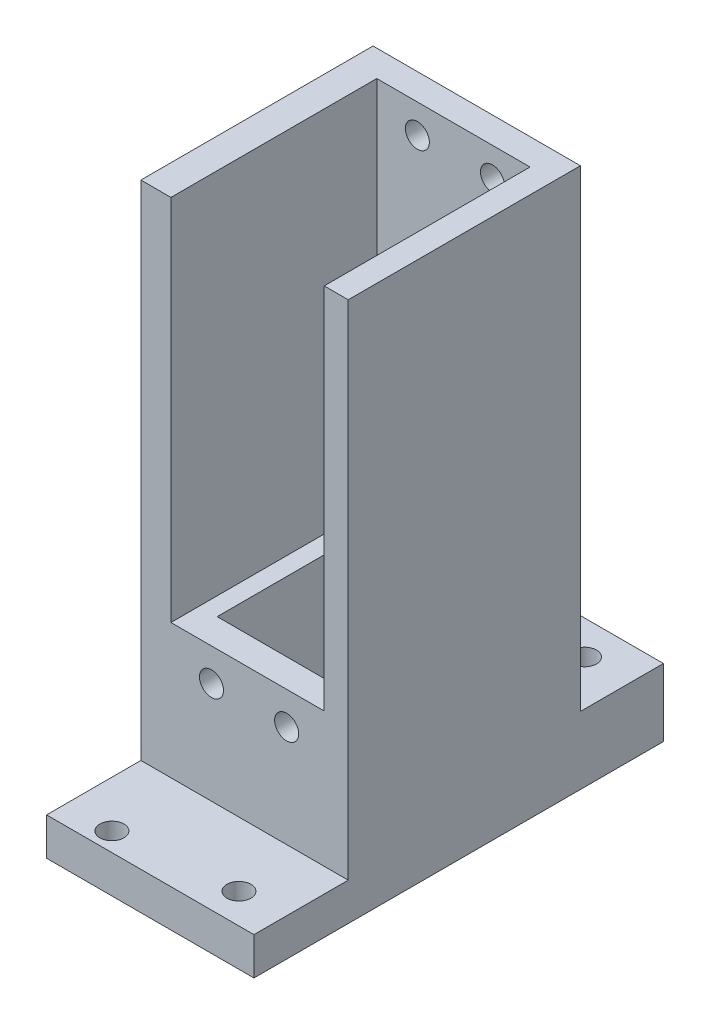
from build123d import *

# Parameters (mm, degrees)
SKETCH1_W               = 25
SKETCH1_H               = 17
BOSS_EXTRUDE1_DEPTH     = 12
MOVE_FACE1_BY           = 15
MOVE_FACE3_BY           = 8
SKETCH3_W               = 25
SKETCH3_H               = 12.751689795
BOSS_EXTRUDE2_DEPTH     = 6.9
SKETCH4_W               = 5
SKETCH4_H               = 16.698310205
BOSS_EXTRUDE3_DEPTH     = 6.9
MOVE_START              = -11.609792285
MOVE_FACE4_OUTLINE_W    = 6.9
MOVE_FACE4_OUTLINE_H    = 16.698310205
MOVE_FACE4_DEPTH        = 2.4
MOVE_FACE5_BY           = 20
SKETCH6_W               = 25
SKETCH6_H               = 10.9
BOSS_EXTRUDE5_DEPTH     = 2
MOVE_FACE6_BY           = 1.5
MOVE_FACE7_BY           = 2.6
SKETCH7_W               = 3.8
SKETCH7_H               = 30.95
BOSS_EXTRUDE6_DEPTH     = 41
SKETCH8_W               = 16.2
SKETCH8_H               = 3.5
BOSS_EXTRUDE7_DEPTH     = 41
SKETCH9_W               = 3
SKETCH9_H               = 30.95
BOSS_EXTRUDE8_DEPTH     = 41
SKETCH10_W              = 4.6
SKETCH10_H              = 3.5
BOSS_EXTRUDE9_DEPTH     = 41
MOVE_FACE8_BY           = 9
MOVE_FACE9_OUTLINE_W    = 6
MOVE_FACE9_OUTLINE_H    = 6.301689795
MOVE_FACE9_OUTLINE_H_2  = 3.5
MOVE_FACE9_DEPTH        = 27.6
MOVE_START_2            = 8.390207715
MOVE_FACE9_2_OUTLINE_W  = 6
MOVE_FACE9_2_OUTLINE_H  = 23.698310205
MOVE_FACE9_2_DEPTH      = 7.6
MOVE_FACE9_3_OUTLINE_W  = 6
MOVE_FACE9_3_OUTLINE_H  = 23.698310205
MOVE_FACE9_3_DEPTH      = 7.4
MOVE_FACE10_BY          = 10
SKETCH11_W              = 27.6
SKETCH11_H              = 3
BOSS_EXTRUDE10_DEPTH    = 11
SKETCH12_R              = 1.5
SKETCH12_R_2            = 1.6
CUT_EXTRUDE1_DEPTH      = 16
SKETCH13_R              = 1.6
CUT_EXTRUDE2_DEPTH      = 5
CUT_EXTRUDE3_START      = -9
SKETCH14_R              = 1.6
CUT_EXTRUDE3_DEPTH      = 9
SKETCH15_R              = 1.6
CUT_EXTRUDE4_DEPTH      = 5
MOVE_FACE14_BY          = 1
MOVE_FACE15_OUTLINE_W   = 16.9
MOVE_FACE15_OUTLINE_H   = 23.698310205
MOVE_FACE15_DEPTH       = 2
MOVE_FACE16_BY          = 8
MOVE_FACE17_BY          = 6
MOVE_FACE19_BY          = 6
MOVE_FACE20_BY          = 5
MOVE_FACE21_BY          = 0.2
MOVE_FACE22_BY          = 0.2
MOVE_START_3            = -12.454005935
MOVE_FACE23_OUTLINE_W   = 27.6
MOVE_FACE23_OUTLINE_H   = 62.9
MOVE_FACE23_DEPTH       = 0.05
MOVE_FACE24_BY          = 0.05
SKETCH17_R              = 1.6
CUT_EXTRUDE5_DEPTH      = 7.5
BOSS_EXTRUDE12_DEPTH    = 2
BOSS_EXTRUDE13_DEPTH    = 46
CUT_EXTRUDE6_DEPTH      = 70.24755409
CUT_EXTRUDE6_DEPTH_BACK = 70.24755409


# Read off the part's stored shape, not the designer's step: Move Face4, Move Face9, Move Face15, Move Face23
with BuildPart() as part:
    # Sketch1 → Boss-Extrude1 (new body)
    with BuildSketch(Plane(origin=(0, 0, 0), x_dir=(1, 0, 0), z_dir=(0, 1, 0))):
        with Locations((0.890207715, 2.454005935)):
            Rectangle(SKETCH1_W, SKETCH1_H)
    extrude(amount=BOSS_EXTRUDE1_DEPTH)

    # Move Face1: a face moved outward by 15.0
    extrude(part.faces().sort_by_distance((0.890207715, 6, 6.045994065))[0], amount=MOVE_FACE1_BY, dir=(0, 0, 1))

    # Move Face3: a face moved inward by 8.0
    extrude(part.faces().sort_by_distance((0.890207715, 12, 5.045994065))[0], amount=MOVE_FACE3_BY, dir=(0, -1, 0), mode=Mode.SUBTRACT)

    # Sketch3 → Boss-Extrude2 (add)
    with BuildSketch(Plane(origin=(0, 4, 0), x_dir=(1, 0, 0), z_dir=(0, 1, 0))):
        with Locations((0.890207715, -12.120149168)):
            Rectangle(SKETCH3_W, SKETCH3_H)
    extrude(amount=BOSS_EXTRUDE2_DEPTH)

    # Sketch4 → Boss-Extrude3 (add)
    with BuildSketch(Plane(origin=(0, 4, 0), x_dir=(1, 0, 0), z_dir=(0, 1, 0))):
        with Locations((10.890207715, 2.604850833)):
            Rectangle(SKETCH4_W, SKETCH4_H)
        with Locations((-6.709792285, 2.604850833)):
            Rectangle(SKETCH4_W, SKETCH4_H)
    extrude(amount=BOSS_EXTRUDE3_DEPTH)

    # Move Face4 outline → Move Face4 (add)
    with BuildSketch(Plane.YZ.offset(MOVE_START)):
        with Locations((7.45, -2.604850833)):
            Rectangle(MOVE_FACE4_OUTLINE_W, MOVE_FACE4_OUTLINE_H)
    extrude(amount=MOVE_FACE4_DEPTH)

    # Move Face5: a face moved inward by 20.0
    extrude(part.faces().sort_by_distance((2.090207715, 4, -2.604850832))[0], amount=MOVE_FACE5_BY, dir=(0, -1, 0), mode=Mode.SUBTRACT)

    # Sketch6 → Boss-Extrude5 (add)
    with BuildSketch(Plane(origin=(0, 0, -10.954005935), x_dir=(-1, 0, 0), z_dir=(0, 0, -1))):
        with Locations((-0.890207715, 5.45)):
            Rectangle(SKETCH6_W, SKETCH6_H)
    extrude(amount=-BOSS_EXTRUDE5_DEPTH)

    # Move Face6: a face moved outward by 1.5
    extrude(part.faces().sort_by_distance((0.890207715, 5.45, -10.954005935))[0], amount=MOVE_FACE6_BY, dir=(0, 0, -1))

    # Move Face7: a face moved outward by 2.6
    extrude(part.faces().sort_by_distance((13.390207715, 5.348749838, 3.512570938))[0], amount=MOVE_FACE7_BY, dir=(1, 0, 0))

    # Sketch7 → Boss-Extrude6 (add)
    with BuildSketch(Plane(origin=(0, 10.9, 0), x_dir=(1, 0, 0), z_dir=(0, 1, 0))):
        with Locations((-9.709792285, -3.020994065)):
            Rectangle(SKETCH7_W, SKETCH7_H)
    extrude(amount=BOSS_EXTRUDE6_DEPTH)

    # Sketch8 → Boss-Extrude7 (add)
    with BuildSketch(Plane(origin=(0, 10.9, 0), x_dir=(1, 0, 0), z_dir=(0, 1, 0))):
        with Locations((0.290207715, 10.704005935)):
            Rectangle(SKETCH8_W, SKETCH8_H)
    extrude(amount=BOSS_EXTRUDE7_DEPTH)

    # Sketch9 → Boss-Extrude8 (add)
    with BuildSketch(Plane(origin=(0, 10.9, 0), x_dir=(1, 0, 0), z_dir=(0, 1, 0))):
        with Locations((14.490207715, -3.020994065)):
            Rectangle(SKETCH9_W, SKETCH9_H)
    extrude(amount=BOSS_EXTRUDE8_DEPTH)

    # Sketch10 → Boss-Extrude9 (add)
    with BuildSketch(Plane(origin=(0, 10.9, 0), x_dir=(1, 0, 0), z_dir=(0, 1, 0))):
        with Locations((10.690207715, 10.704005935)):
            Rectangle(SKETCH10_W, SKETCH10_H)
    extrude(amount=BOSS_EXTRUDE9_DEPTH)

    # Move Face8: a face moved inward by 9.0
    extrude(part.faces().sort_by_distance((2.090207715, 5.45, 5.74430427))[0], amount=MOVE_FACE8_BY, dir=(0, 0, 1), mode=Mode.SUBTRACT)

    # Move Face9 outline → Move Face9 (add)
    with BuildSketch(Plane.YZ.offset(MOVE_START)):
        with Locations((-3, 17.895149168)):
            Rectangle(MOVE_FACE9_OUTLINE_W, MOVE_FACE9_OUTLINE_H)
        with Locations((-3, -10.704005935)):
            Rectangle(MOVE_FACE9_OUTLINE_W, MOVE_FACE9_OUTLINE_H_2)
    extrude(amount=MOVE_FACE9_DEPTH)

    # Move Face9 2 outline → Move Face9 2 (add)
    with BuildSketch(Plane.YZ.offset(MOVE_START_2)):
        with Locations((-3, 2.895149167)):
            Rectangle(MOVE_FACE9_2_OUTLINE_W, MOVE_FACE9_2_OUTLINE_H)
    extrude(amount=MOVE_FACE9_2_DEPTH)

    # Move Face9 3 outline → Move Face9 3 (add)
    with BuildSketch(Plane.YZ.offset(MOVE_START)):
        with Locations((-3, 2.895149167)):
            Rectangle(MOVE_FACE9_3_OUTLINE_W, MOVE_FACE9_3_OUTLINE_H)
    extrude(amount=MOVE_FACE9_3_DEPTH)

    # Move Face10: a face moved outward by 10.0
    extrude(part.faces().sort_by_distance((2.190207715, -1, 21.045994065))[0], amount=MOVE_FACE10_BY, dir=(0, 0, 1))

    # Sketch11 → Boss-Extrude10 (add)
    with BuildSketch(Plane(origin=(0, 0, -12.454005935), x_dir=(-1, 0, 0), z_dir=(0, 0, -1))):
        with Locations((-2.190207715, -4.5)):
            Rectangle(SKETCH11_W, SKETCH11_H)
    extrude(amount=BOSS_EXTRUDE10_DEPTH)

    # Sketch12 → Cut-Extrude1 (cut)
    with BuildSketch(Plane.XZ.offset(6)):
        with Locations(Location((-5.378312816, -20.454005935, 0), (0, 0, 270))):
            Circle(SKETCH12_R)
        with Locations(Location((-5.415791402, 28.545994065, 0), (0, 0, 270))):
            Circle(SKETCH12_R_2)
    extrude(amount=-CUT_EXTRUDE1_DEPTH, mode=Mode.SUBTRACT)

    # Sketch13 → Cut-Extrude2 (cut)
    with BuildSketch(Plane(origin=(0, -3, 0), x_dir=(1, 0, 0), z_dir=(0, 1, 0))):
        with Locations(Location((9.990207715, 18.954005935, 0), (0, 0, 180))):
            Circle(SKETCH13_R)
        with Locations(Location((9.990207715, -27.045994065, 0), (0, 0, 180))):
            Circle(SKETCH13_R)
    extrude(amount=-CUT_EXTRUDE2_DEPTH, mode=Mode.SUBTRACT)

    # Sketch14 → Cut-Extrude3 (cut)
    with BuildSketch(Plane.XZ.offset(3).offset(CUT_EXTRUDE3_START)):
        with Locations(Location((9.990207715, 27.045994065, 0), (0, 0, 90))):
            Circle(SKETCH14_R)
    extrude(amount=CUT_EXTRUDE3_DEPTH, mode=Mode.SUBTRACT)

    # Sketch15 → Cut-Extrude4 (cut)
    with BuildSketch(Plane.XY.offset(18.495994065)):
        with Locations((-2.209792285, 6.55)):
            Circle(SKETCH15_R)
        with Locations((7.790207715, 6.55)):
            Circle(SKETCH15_R)
    extrude(amount=-CUT_EXTRUDE4_DEPTH, mode=Mode.SUBTRACT)

    # Move Face14: a face moved inward by 1.0
    extrude(part.faces().sort_by_distance((-4.209792285, 2.45, 2.895149168))[0], amount=MOVE_FACE14_BY, dir=(-1, 0, 0), mode=Mode.SUBTRACT)

    # Move Face15 outline → Move Face15 (cut)
    with BuildSketch(Plane.YZ.offset(MOVE_START_2)):
        with Locations((2.45, 2.895149167)):
            Rectangle(MOVE_FACE15_OUTLINE_W, MOVE_FACE15_OUTLINE_H)
    extrude(amount=MOVE_FACE15_DEPTH, mode=Mode.SUBTRACT)

    # Move Face16: a face moved outward by 8.0
    extrude(part.faces().sort_by_distance((2.190207715, 51.9, -9.359005935))[0], amount=MOVE_FACE16_BY, dir=(0, 1, 0))

    # Move Face17: a face moved inward by 6.0
    extrude(part.faces().sort_by_distance((2.185483915, 4, 24.62368036))[0], amount=MOVE_FACE17_BY, dir=(0, -1, 0), mode=Mode.SUBTRACT)

    # Move Face19: a face moved outward by 6.0
    extrude(part.faces().sort_by_distance((13.230207715, -6, 3.795994065))[0], amount=MOVE_FACE19_BY, dir=(0, -1, 0))

    # Move Face20: a face moved inward by 5.0
    extrude(part.faces().sort_by_distance((2.185483915, -2, 24.62368036))[0], amount=MOVE_FACE20_BY, dir=(0, -1, 0), mode=Mode.SUBTRACT)

    # Move Face21: a face moved outward by 0.2
    extrude(part.faces().sort_by_distance((-7.809792285, 35.4, 4.770994065))[0], amount=MOVE_FACE21_BY, dir=(1, 0, 0))

    # Move Face22: a face moved outward by 0.2
    extrude(part.faces().sort_by_distance((12.990207715, 35.4, 4.770994065))[0], amount=MOVE_FACE22_BY, dir=(-1, 0, 0))

    # Move Face23 outline → Move Face23 (cut)
    with BuildSketch(Plane.XY.offset(MOVE_START_3)):
        with Locations((2.190207715, 28.45)):
            Rectangle(MOVE_FACE23_OUTLINE_W, MOVE_FACE23_OUTLINE_H)
    extrude(amount=MOVE_FACE23_DEPTH, mode=Mode.SUBTRACT)

    # Move Face24: a face moved outward by 0.05
    extrude(part.faces().sort_by_distance((2.590207715, 25.934788184, -8.954005935))[0], amount=MOVE_FACE24_BY, dir=(0, 0, 1))

    # Sketch17 → Cut-Extrude5 (cut)
    with BuildSketch(Plane.XY.offset(-8.904005935)):
        with Locations((-2.209792285, 56.05)):
            Circle(SKETCH17_R)
        with Locations((7.790207715, 56.05)):
            Circle(SKETCH17_R)
    extrude(amount=-CUT_EXTRUDE5_DEPTH, mode=Mode.SUBTRACT)

    # Sketch19 → Boss-Extrude12 (add)
    with BuildSketch(Plane(origin=(3.990207715, 0, 0), x_dir=(0, 0, -1), z_dir=(1, 0, 0))):
        Polygon((23.454005935, -3), (12.404005935, 43), (12.404005935, -3), align=None)
    extrude(amount=-BOSS_EXTRUDE12_DEPTH)

    # Sketch20 → Boss-Extrude13 (add)
    with BuildSketch(Plane(origin=(0, -3, 0), x_dir=(1, 0, 0), z_dir=(0, 1, 0))):
        Polygon((1.990207715, 15.804005935), (-1.409792285, 12.404005935), (1.990207715, 12.404005935), align=None)
        Polygon((3.990207715, 15.804005935), (7.390207715, 12.404005935), (3.990207715, 12.404005935), align=None)
    extrude(amount=BOSS_EXTRUDE13_DEPTH)

    # Sketch21 → Cut-Extrude6 (cut, two sides: drawn at the far end of the back side and taken through both)
    with BuildSketch(Plane(origin=(3.990207715, 0, 0), x_dir=(0, 0, -1), z_dir=(1, 0, 0)).offset(-CUT_EXTRUDE6_DEPTH_BACK)):
        Polygon((15.902869946, 28.434593255), (12.404005935, 43), (16.038201458, 43), align=None)
    extrude(amount=CUT_EXTRUDE6_DEPTH + CUT_EXTRUDE6_DEPTH_BACK, mode=Mode.SUBTRACT)


solid = part.part
